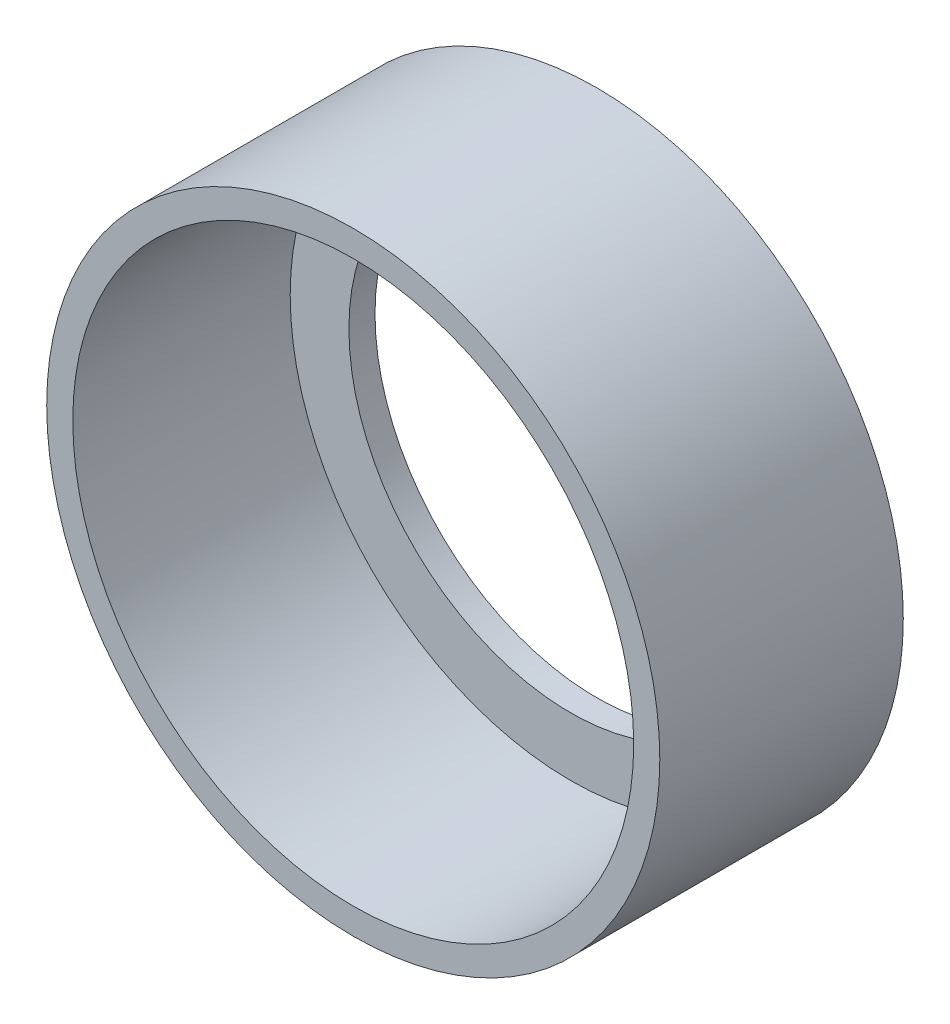
from build123d import *


with BuildPart() as part:
    # Sketch1 → Revolve1 (revolve)
    with BuildSketch(Plane(origin=(0, 0, 0), x_dir=(1, 0, 0), z_dir=(0, 1, 0))):
        Polygon((16.383, 5.425637802), (17.907, 5.425637802), (17.907, 19.649637802), (12.954, 19.649637802), (12.954, 18.125637802), (16.383, 18.125637802), align=None)
    revolve(axis=Axis((0, 0, -10.179008168), (0, 0, 1)))


solid = part.part
